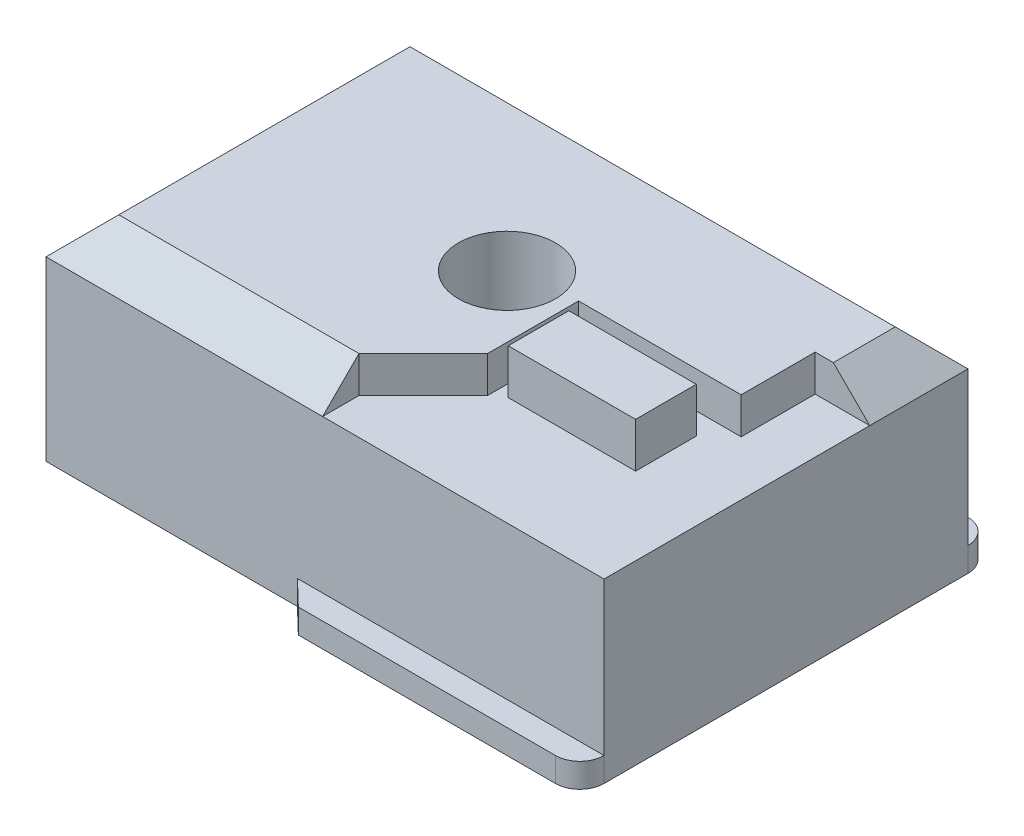
from build123d import *

# Parameters (mm, degrees)
SKETCH_13_R         = 4.5
EXTRUDE_8_DEPTH     = 2
SKETCH_14_W         = 46
SKETCH_14_H         = 30
SKETCH_14_R         = 4.5
EXTRUDE_9_DEPTH     = 14.6
SKETCH_15_W         = 40
SKETCH_15_H         = 24
SKETCH_15_R         = 4
EXTRUDE_10_DEPTH    = 17.6
EXTRUDE_START       = 12
EXTRUDE_11_DEPTH    = 24
EXTRUDE_START_2     = -23
EXTRUDE_12_DEPTH    = 46
EXTRUDE_START_3     = -16
EXTRUDE_12_2_DEPTH  = 32
CUT_EXTRUDE_START   = 17.6
CUT_EXTRUDE_2_DEPTH = 3
EXTRUDE_START_4     = 14.6
SKETCH_19_W         = 10.5
SKETCH_19_H         = 5
EXTRUDE_13_DEPTH    = 3.7


with BuildPart() as part:
    # 草图13 → 凸台-拉伸8 (new body)
    with BuildSketch(Plane(origin=(0, 0, 0), x_dir=(1, 0, 0), z_dir=(0, 1, 0))):
        with BuildLine():
            Line((-23, -14.3), (-3, -14.3))
            Line((-3, -14.3), (-0.2, -17))
            Line((-0.2, -17), (21, -17))
            ThreePointArc((21, -17), (22.414213562, -16.414213562), (23, -15))
            Line((23, -15), (23, 15))
            ThreePointArc((23, 15), (22.414213562, 16.414213562), (21, 17))
            Line((21, 17), (-21, 17))
            ThreePointArc((-21, 17), (-22.414213562, 16.414213562), (-23, 15))
            Line((-23, 15), (-23, -14.3))
        make_face()
        with Locations(Location((0, 0, 0), (0, 0, 270))):
            Circle(SKETCH_13_R, mode=Mode.SUBTRACT)
    extrude(amount=EXTRUDE_8_DEPTH)

    # 草图14 → 凸台-拉伸9 (add)
    with BuildSketch(Plane(origin=(0, 0, 0), x_dir=(1, 0, 0), z_dir=(0, 1, 0))):
        Rectangle(SKETCH_14_W, SKETCH_14_H)
        with Locations(Location((0, 0, 0), (0, 0, 270))):
            Circle(SKETCH_14_R, mode=Mode.SUBTRACT)
    extrude(amount=EXTRUDE_9_DEPTH)

    # 草图15 → 凸台-拉伸10 (add)
    with BuildSketch(Plane(origin=(0, 0, 0), x_dir=(1, 0, 0), z_dir=(0, 1, 0))):
        Rectangle(SKETCH_15_W, SKETCH_15_H)
        with Locations(Location((0, 0, 0), (0, 0, 270))):
            Circle(SKETCH_15_R, mode=Mode.SUBTRACT)
    extrude(amount=EXTRUDE_10_DEPTH)

    # 草图16 → 凸台-拉伸11 (add)
    with BuildSketch(Plane.XY.offset(EXTRUDE_START)):
        Polygon((-20, 14.6), (-20, 17.6), (-23, 14.6), align=None)
        Polygon((20, 17.6), (20, 14.6), (23, 14.6), align=None)
    extrude(amount=-EXTRUDE_11_DEPTH)

    # 凸台-拉伸12: read off the stored shape, not the designer's step
    # 凸台-拉伸12 outline → 凸台-拉伸12 (add)
    with BuildSketch(Plane(origin=(0, 0, 0), x_dir=(0, 0, -1), z_dir=(1, 0, 0)).offset(EXTRUDE_START_2)):
        Polygon((15, 14.6), (12, 17.6), (12, 14.6), align=None)
        Polygon((-12, 17.6), (-15, 14.6), (-12, 14.6), align=None)
    extrude(amount=EXTRUDE_12_DEPTH)

    # Extrude 12 2 outline → Extrude 12 2 (cut)
    with BuildSketch(Plane.XY.offset(EXTRUDE_START_3)):
        Polygon((-23, 14.6), (-18.6, 19), (-23, 19), align=None)
        Polygon((23, 19), (18.6, 19), (23, 14.6), align=None)
    extrude(amount=EXTRUDE_12_2_DEPTH, mode=Mode.SUBTRACT)

    # 草图18 → 切除-拉伸2 (cut)
    with BuildSketch(Plane(origin=(0, 0, 0), x_dir=(1, 0, 0), z_dir=(0, 1, 0)).offset(CUT_EXTRUDE_START)):
        Polygon((-0.2, -15), (-0.2, -12), (5.1, -6.7), (5.1, 0.8), (18.5, 0.8), (18.5, 6.9), (23, 6.9), (23, -15), align=None)
    extrude(amount=-CUT_EXTRUDE_2_DEPTH, mode=Mode.SUBTRACT)


with BuildPart() as body_2:
    # 草图19 → 凸台-拉伸13 (new body)
    with BuildSketch(Plane(origin=(0, 0, 0), x_dir=(1, 0, 0), z_dir=(0, 1, 0)).offset(EXTRUDE_START_4)):
        with Locations((11.35, -3.5)):
            Rectangle(SKETCH_19_W, SKETCH_19_H)
    extrude(amount=EXTRUDE_13_DEPTH)


solid = Compound([part.part, body_2.part])
